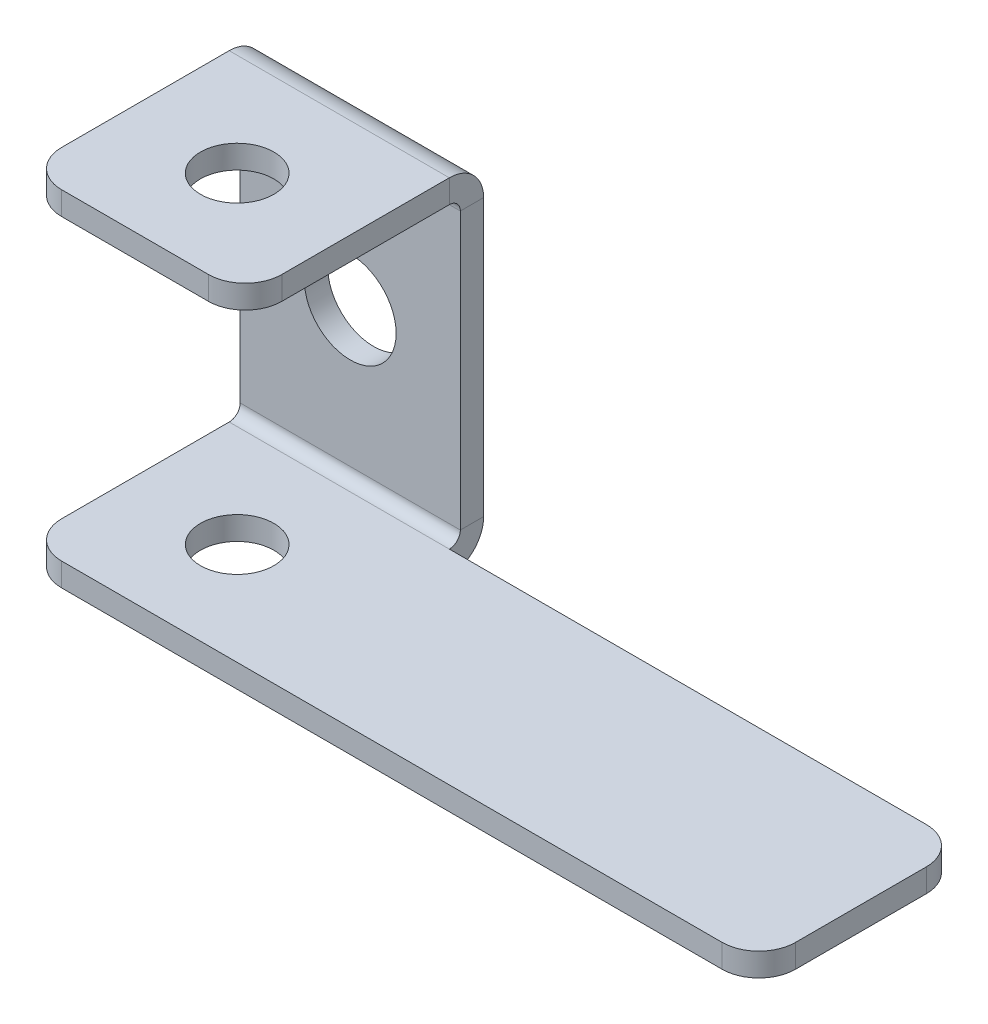
from build123d import *

# Parameters (mm, degrees)
SKETCH1_W                      = 60
SKETCH1_H                      = 94
BASE_FLANGE1_DEPTH             = 6.35
EDGE_FLANGE1_STRIP_W           = 31.4
EDGE_FLANGE1_STRIP_H           = 6.35
EDGE_FLANGE1_STRIP_CUT_DEPTH   = 60
EDGE_FLANGE1_STRIP_2_W         = 31.4
EDGE_FLANGE1_STRIP_2_H         = 6.35
EDGE_FLANGE1_STRIP_CUT_2_DEPTH = 60
EDGE_FLANGE1_DEPTH             = 60
EDGE_FLANGE1_BEND_DEPTH        = 60
SKETCH12_W                     = 200
SKETCH12_H                     = 55.65
TAB1_DEPTH                     = 6.35
FILLET2_R                      = 10
SKETCH14_R                     = 12.5
CUT_EXTRUDE1_DEPTH             = 186.873135498
SKETCH15_R                     = 10
CUT_EXTRUDE2_DEPTH             = 203.918265565


# Sheet-metal steps are written as plain solids
with BuildPart() as part:
    # Sketch1 → Base-Flange1 (new body)
    with BuildSketch(Plane.XY):
        Rectangle(SKETCH1_W, SKETCH1_H)
    extrude(amount=-BASE_FLANGE1_DEPTH)

    # Edge-Flange1 strip (across the edge) → Edge-Flange1 strip cut (cut)
    with BuildSketch(Plane(origin=(30, 47, 0), x_dir=(0, -1, 0), z_dir=(-1, 0, 0))):
        with Locations((-6.35, -3.175)):
            Rectangle(EDGE_FLANGE1_STRIP_W, EDGE_FLANGE1_STRIP_H)
    extrude(amount=EDGE_FLANGE1_STRIP_CUT_DEPTH, mode=Mode.SUBTRACT)

    # Edge-Flange1 strip 2 (across the edge) → Edge-Flange1 strip cut 2 (cut)
    with BuildSketch(Plane(origin=(-30, -47, 0), x_dir=(0, 1, 0), z_dir=(1, 0, 0))):
        with Locations((-6.35, -3.175)):
            Rectangle(EDGE_FLANGE1_STRIP_2_W, EDGE_FLANGE1_STRIP_2_H)
    extrude(amount=EDGE_FLANGE1_STRIP_CUT_2_DEPTH, mode=Mode.SUBTRACT)

    # Edge-Flange1 section (across the edge) → Edge-Flange1 (add)
    with BuildSketch(Plane(origin=(30, 47, 0), x_dir=(0, -1, 0), z_dir=(-1, 0, 0))):
        with BuildLine():
            Line((0, 3), (0, 58.65))
            Line((0, 58.65), (6.35, 58.65))
            Line((6.35, 58.65), (6.35, 3))
            ThreePointArc((6.35, 3), (7.228679656, 0.878679656), (9.35, 0))
            Line((9.35, 0), (9.35, -6.35))
            ThreePointArc((9.35, -6.35), (2.738551596, -3.611448404), (0, 3))
        make_face()
    extrude(amount=EDGE_FLANGE1_DEPTH)

    # Edge-Flange1 section 2 (across the edge) → Edge-Flange1 bend (add)
    with BuildSketch(Plane(origin=(-30, -47, 0), x_dir=(0, 1, 0), z_dir=(1, 0, 0))):
        with BuildLine():
            Line((0, 3), (0, 58.65))
            Line((0, 58.65), (6.35, 58.65))
            Line((6.35, 58.65), (6.35, 3))
            ThreePointArc((6.35, 3), (7.228679656, 0.878679656), (9.35, 0))
            Line((9.35, 0), (9.35, -6.35))
            ThreePointArc((9.35, -6.35), (2.738551596, -3.611448404), (0, 3))
        make_face()
    extrude(amount=EDGE_FLANGE1_BEND_DEPTH)

    # Sketch12 → Tab1 (add)
    with BuildSketch(Plane(origin=(0, -40.65, 0), x_dir=(1, 0, 0), z_dir=(0, 1, 0))):
        with Locations((70, -30.825)):
            Rectangle(SKETCH12_W, SKETCH12_H)
    extrude(amount=-TAB1_DEPTH)

    # Fillet2
    fillet2_edges = [part.edges().sort_by_distance(p)[0] for p in [
        (30, 43.825, 58.65),
        (-30, 43.825, 58.65),
        (-30, -43.825, 58.65),
        (170, -43.825, 58.65),
        (170, -43.825, 3),
    ]]
    fillet(fillet2_edges, radius=FILLET2_R)

    # Sketch14 → Cut-Extrude1 (cut, through all)
    with BuildSketch(Plane.XY):
        Circle(SKETCH14_R)
    extrude(amount=-CUT_EXTRUDE1_DEPTH, mode=Mode.SUBTRACT)

    # Sketch15 → Cut-Extrude2 (cut, through all)
    with BuildSketch(Plane(origin=(0, 47, 0), x_dir=(1, 0, 0), z_dir=(0, 1, 0))):
        with Locations(Location((0, -30.825, 0), (0, 0, 270))):
            Circle(SKETCH15_R)
    extrude(amount=-CUT_EXTRUDE2_DEPTH, mode=Mode.SUBTRACT)


solid = part.part
